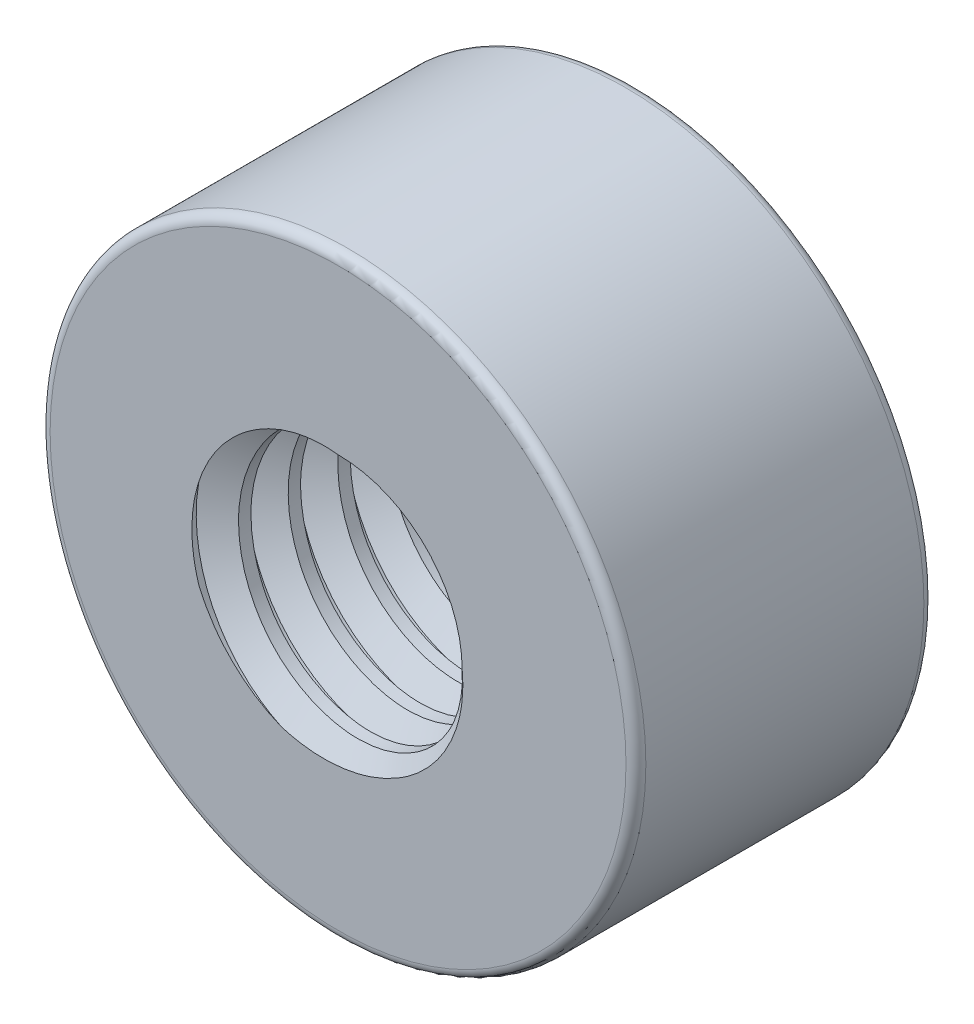
from build123d import *

# Parameters (mm, degrees)
SKETCH_3_R          = 3
EXTRUDE_1_DEPTH     = 3
FILLET_1_R          = 0.1
SKETCH_5_R          = 1.25
CUT_EXTRUDE_1_DEPTH = 3
THREAD_2_PITCH      = 0.5


with BuildPart() as part:
    # Sketch 3 → 凸台-拉伸1 (new body)
    with BuildSketch(Plane.XY):
        Circle(SKETCH_3_R)
    extrude(amount=EXTRUDE_1_DEPTH)

    # 圆角1
    fillet_1_edges = [part.edges().sort_by_distance(p)[0] for p in [
        (-3, 0, 0),
        (-3, 0, 3),
    ]]
    fillet(fillet_1_edges, radius=FILLET_1_R)

    # 草图5 → 切除-拉伸1 (cut)
    with BuildSketch(Plane.XY.offset(3)):
        Circle(SKETCH_5_R)
    extrude(amount=-CUT_EXTRUDE_1_DEPTH, mode=Mode.SUBTRACT)

    # 螺纹线2: the profile of Sketch 3 2 profile screwed along a right-hand helix of 8 turns, 6 arcs to a turn; built about Z, then put on its axis
    thread_2_z = Axis((0, 0, 0), (0, 0, 1))
    thread_2_corners = [(1.2497, 0, -0.000173205), (1.520632938, 0, 0.156249999), (1.520632937, 0, 0.218749999), (1.2497, 0, 0.375173204)]
    with BuildLine(mode=Mode.PRIVATE) as thread_2_profile:
        Line(thread_2_corners[0], thread_2_corners[1])
        Line(thread_2_corners[1], thread_2_corners[2])
        Line(thread_2_corners[2], thread_2_corners[3])
        Line(thread_2_corners[3], thread_2_corners[0])
    thread_2_cap = Face(thread_2_profile.wire())
    thread_2_turn_angles = [0, 30, 60, 90, 120, 150, 180, 210, 240, 270, 300, 330, 360]
    thread_2_turn_weights = [1, 0.8660254037844387, 1, 0.8660254037844387, 1, 0.8660254037844387, 1, 0.8660254037844387, 1, 0.8660254037844387, 1, 0.8660254037844387, 1]
    thread_2_turn_rails = [Edge.make_bspline([Vector(p[0], p[1], 0).rotate(thread_2_z, thread_2_turn_angles[k]) / thread_2_turn_weights[k] + Vector(0, 0, p[2] + THREAD_2_PITCH * thread_2_turn_angles[k] / 360) for k in range(13)], [0, 0, 0, 1, 1, 2, 2, 3, 3, 4, 4, 5, 5, 6, 6, 6], 2, thread_2_turn_weights) for p in thread_2_corners]
    thread_2_turn_sides = [Face.make_surface_from_curves(thread_2_turn_rails[p[0]], thread_2_turn_rails[p[1]]) for p in [(0, 1), (1, 2), (2, 3), (3, 0)]]
    thread_2 = Plane(origin=(0, 0, -1), x_dir=(1, 0, 0), z_dir=(0, 0, 1)) * Solid(Shell([*[p.moved(Location((0, 0, THREAD_2_PITCH * i))) for i in range(8) for p in thread_2_turn_sides], thread_2_cap, thread_2_cap.rotate(thread_2_z, 2880).moved(Location((0, 0, THREAD_2_PITCH * 2880 / 360)))]))
    add(thread_2, mode=Mode.SUBTRACT)


solid = part.part
